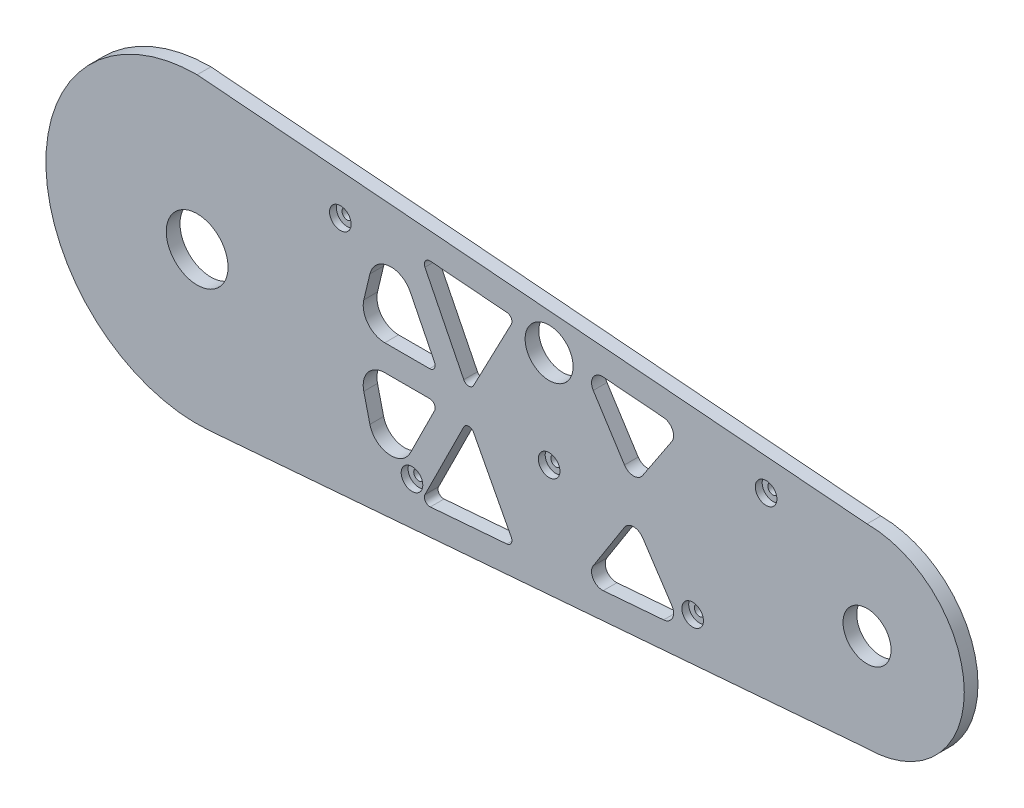
from build123d import *

# Parameters (mm, degrees)
SKETCH1_R             = 14.29385
SKETCH1_R_2           = 11.116
SKETCH1_R_3           = 11.1125
BOSS_EXTRUDE1_DEPTH   = 6.35
CROQUIS1_R            = 2.38125
CORTAR_EXTRUIR1_DEPTH = 50
CROQUIS6_R            = 2.38125
CORTAR_EXTRUIR4_DEPTH = 10
CROQUIS7_R            = 2.38125
CORTAR_EXTRUIR5_DEPTH = 10
CROQUIS9_R            = 5
CORTAR_EXTRUIR6_DEPTH = 3.18
REDONDEO1_R           = 10


with BuildPart() as part:
    # Sketch1 → Boss-Extrude1 (new body)
    with BuildSketch(Plane.XY):
        with BuildLine():
            Line((0, 70), (310, 45))
            ThreePointArc((310, 45), (355, 0), (310, -45))
            Line((310, -45), (5.171398252, -69.808714643))
            ThreePointArc((5.171398252, -69.808714643), (-69.952162315, -2.587467389), (0, 70))
        make_face()
        Circle(SKETCH1_R, mode=Mode.SUBTRACT)
        with Locations((310, 0)):
            Circle(SKETCH1_R_2, mode=Mode.SUBTRACT)
        with Locations((162.878542763, 40)):
            Circle(SKETCH1_R_3, mode=Mode.SUBTRACT)
        with BuildLine():
            Line((107.898974887, 49.259511156), (143.314248041, 46.40344074))
            ThreePointArc((143.314248041, 46.40344074), (145.347881954, 45.088830366), (145.372448632, 42.667412639))
            Line((145.372448632, 42.667412639), (127.930019685, 9.427678699))
            ThreePointArc((127.930019685, 9.427678699), (125.6391409, 8.05925631), (123.377877991, 9.476082164))
            Line((123.377877991, 9.476082164), (105.405033784, 45.571886519))
            ThreePointArc((105.405033784, 45.571886519), (105.575858768, 48.143496249), (107.898974887, 49.259511156))
        make_face(mode=Mode.SUBTRACT)
        with BuildLine():
            Line((78.877001486, 6), (107.574716075, 6))
            ThreePointArc((107.574716075, 6), (109.748229039, 7.210627227), (109.863160313, 9.695897371))
            Line((109.863160313, 9.695897371), (98.618428674, 32.279280868))
            ThreePointArc((98.618428674, 32.279280868), (88.534599172, 37.75775058), (79.941746192, 30.151166228))
            Line((79.941746192, 30.151166228), (74.697701734, 8.255286248))
            ThreePointArc((74.697701734, 8.255286248), (76.502508778, 6.599797234), (78.877001486, 6))
        make_face(mode=Mode.SUBTRACT)
        with BuildLine():
            Line((219.623774494, 32.810522613), (206.130928429, 12.417497436))
            ThreePointArc((206.130928429, 12.417497436), (201.919524559, 10.176643248), (197.745901529, 12.48710226))
            Line((197.745901529, 12.48710226), (183.296864227, 35.133505128))
            ThreePointArc((183.296864227, 35.133505128), (183.227765467, 40.400743015), (187.913912204, 42.80669363))
            Line((187.913912204, 42.80669363), (215.855795571, 40.553315939))
            ThreePointArc((215.855795571, 40.553315939), (219.949772588, 37.757395035), (219.623774494, 32.810522613))
        make_face(mode=Mode.SUBTRACT)
        with BuildLine():
            Line((98.618428674, -32.279280868), (109.863160313, -9.695897371))
            ThreePointArc((109.863160313, -9.695897371), (109.748229039, -7.210627227), (107.574716075, -6))
            Line((107.574716075, -6), (78.877001486, -6))
            ThreePointArc((78.877001486, -6), (76.502508778, -6.599797234), (74.697701734, -8.255286248))
            Line((74.697701734, -8.255286248), (79.941746192, -30.151166228))
            ThreePointArc((79.941746192, -30.151166228), (88.534599172, -37.75775058), (98.618428674, -32.279280868))
        make_face(mode=Mode.SUBTRACT)
        with BuildLine():
            Line((187.913912204, -42.80669363), (215.855795571, -40.553315939))
            ThreePointArc((215.855795571, -40.553315939), (219.949772588, -37.757395035), (219.623774494, -32.810522613))
            Line((219.623774494, -32.810522613), (206.130928429, -12.417497436))
            ThreePointArc((206.130928429, -12.417497436), (201.919524559, -10.176643248), (197.745901529, -12.48710226))
            Line((197.745901529, -12.48710226), (183.296864227, -35.133505128))
            ThreePointArc((183.296864227, -35.133505128), (183.227765467, -40.400743015), (187.913912204, -42.80669363))
        make_face(mode=Mode.SUBTRACT)
        with BuildLine():
            Line((123.377877991, -9.476082164), (105.405033784, -45.571886519))
            ThreePointArc((105.405033784, -45.571886519), (105.575858768, -48.143496249), (107.898974887, -49.259511156))
            Line((107.898974887, -49.259511156), (143.314248041, -46.40344074))
            ThreePointArc((143.314248041, -46.40344074), (145.347881954, -45.088830366), (145.372448632, -42.667412639))
            Line((145.372448632, -42.667412639), (127.930019685, -9.427678699))
            ThreePointArc((127.930019685, -9.427678699), (125.6391409, -8.05925631), (123.377877991, -9.476082164))
        make_face(mode=Mode.SUBTRACT)
    extrude(amount=BOSS_EXTRUDE1_DEPTH)

    # Croquis1 → Cortar-Extruir1 (cut)
    with BuildSketch(Plane.XY.offset(6.35)):
        with Locations((99.417366651, -42.272966779)):
            Circle(CROQUIS1_R)
        with Locations((229.299162877, -31.702435007)):
            Circle(CROQUIS1_R)
    extrude(amount=-CORTAR_EXTRUIR1_DEPTH, mode=Mode.SUBTRACT)

    # Croquis6 → Cortar-Extruir4 (cut)
    with BuildSketch(Plane(origin=(0, 0, 0), x_dir=(-1, 0, 0), z_dir=(0, 0, -1))):
        with Locations((-162.878542763, -5)):
            Circle(CROQUIS6_R)
    extrude(amount=-CORTAR_EXTRUIR4_DEPTH, mode=Mode.SUBTRACT)

    # Croquis7 → Cortar-Extruir5 (cut)
    with BuildSketch(Plane(origin=(0, 0, 0), x_dir=(-1, 0, 0), z_dir=(0, 0, -1))):
        with Locations((-66.263169386, 45.68611009)):
            Circle(CROQUIS7_R)
        with Locations((-263.293381054, 34.027262471)):
            Circle(CROQUIS7_R)
    extrude(amount=-CORTAR_EXTRUIR5_DEPTH, mode=Mode.SUBTRACT)

    # Croquis9 → Cortar-Extruir6 (cut)
    with BuildSketch(Plane.XY.offset(6.35)):
        with Locations((66.263169386, 45.68611009)):
            Circle(CROQUIS9_R)
        with Locations((162.878542763, -5)):
            Circle(CROQUIS9_R)
        with Locations((99.417366651, -42.272966779)):
            Circle(CROQUIS9_R)
        with Locations((229.299162877, -31.702435007)):
            Circle(CROQUIS9_R)
        with Locations((263.293381054, 34.027262471)):
            Circle(CROQUIS9_R)
    extrude(amount=-CORTAR_EXTRUIR6_DEPTH, mode=Mode.SUBTRACT)

    # Redondeo1
    redondeo1_edges = [part.edges().sort_by_distance(p)[0] for p in [
        (74.697701734, 8.255286248, 3.175),
        (74.697701734, -8.255286248, 3.175),
    ]]
    fillet(redondeo1_edges, radius=REDONDEO1_R)


solid = part.part
